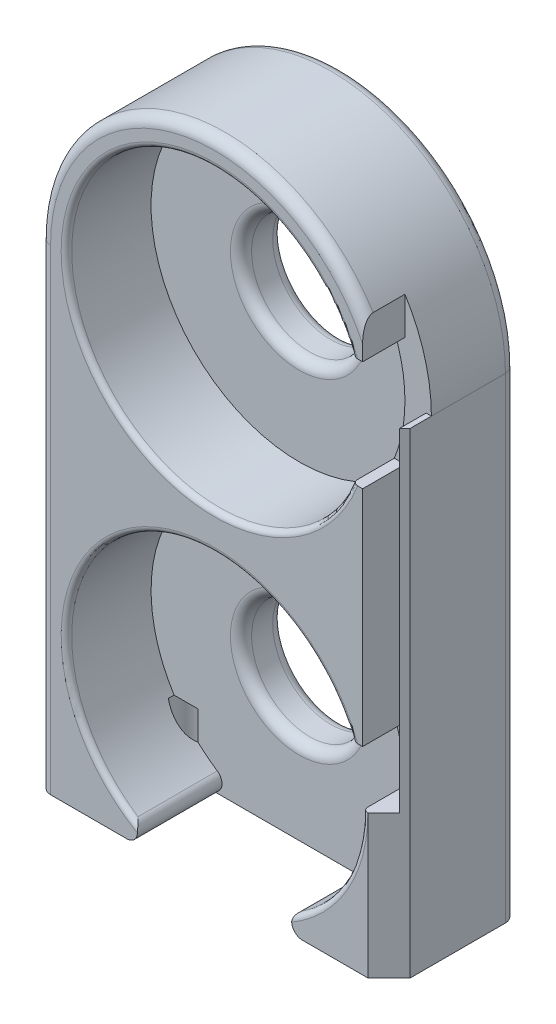
from build123d import *

# Parameters (mm, degrees)
ESBO_O1_R                = 5.5
RESSALTO_EXTRUS_O1_DEPTH = 12
ESBO_O2_R                = 14
CORTE_EXTRUS_O1_DEPTH    = 8
CORTE_EXTRUS_O2_DEPTH    = 4
FILETE7_R                = 1
FILETE9_R                = 0.5
ESBO_O6_R                = 1.75
CORTE_EXTRUS_O3_DEPTH    = 6
CHANFRO1_SIZE            = 2
FILETE10_R               = 1


with BuildPart() as part:
    # Esboço1 → Ressalto-extrusão1 (new body)
    with BuildSketch(Plane.XY):
        with BuildLine():
            Line((-16.5, 0), (-16.5, 45))
            ThreePointArc((-16.5, 45), (0, 61.5), (16.5, 45))
            Line((16.5, 45), (16.5, 0))
            Line((16.5, 0), (-16.5, 0))
        make_face()
        with Locations((0, 45)):
            Circle(ESBO_O1_R, mode=Mode.SUBTRACT)
        with Locations((0, 13.5)):
            Circle(ESBO_O1_R, mode=Mode.SUBTRACT)
    extrude(amount=RESSALTO_EXTRUS_O1_DEPTH)

    # Esboço2 → Corte-extrusão1 (cut)
    with BuildSketch(Plane.XY.offset(12)):
        with Locations((0, 45)):
            Circle(ESBO_O2_R)
        with Locations((0, 13.5)):
            Circle(ESBO_O2_R)
    extrude(amount=-CORTE_EXTRUS_O1_DEPTH, mode=Mode.SUBTRACT)

    # Esboço5 → Corte-extrusão2 (cut)
    with BuildSketch(Plane.XY.offset(12)):
        Polygon((16, 13.5), (16, 45), (16.5, 45), (18, 45), (18, 49.031128874), (16, 49.031128874), (16, 53.732124598), (14, 53.732124598), (14, 50.196152423), (13, 50.196152423), (13, 39.803847577), (14, 39.803847577), (14, 18.696152423), (13, 18.696152423), (13, 13.5), (14, 13.5), align=None)
    extrude(amount=-CORTE_EXTRUS_O2_DEPTH, mode=Mode.SUBTRACT)

    # Filete7
    filete7_edges = [part.edges().sort_by_distance(p)[0] for p in [
        (-5.5, 45, 0),
        (-5.5, 13.5, 0),
        (-16.5, 22.5, 12),
        (-5.5, 45, 4),
        (-5.5, 13.5, 4),
        (-4.541475531, 60.862692079, 12),
        (-16.5, 22.5, 0),
        (0, 61.5, 0),
        (16.5, 22.5, 0),
    ]]
    fillet(filete7_edges, radius=FILETE7_R)

    # Filete9
    filete9_edges = [part.edges().sort_by_distance(p)[0] for p in [
        (-14, 45, 12),
        (11.133584091, 5.01216722, 12),
        (-10.43893595, 22.828912918, 12),
    ]]
    fillet(filete9_edges, radius=FILETE9_R)

    # Esboço6 → Corte-extrusão3 (cut)
    with BuildSketch(Plane.XZ):
        with Locations(Location((-14, 9, 0), (0, 0, 270))):
            Circle(ESBO_O6_R)
        with Locations(Location((14, 9, 0), (0, 0, 270))):
            Circle(ESBO_O6_R)
        with Locations(Location((11, 3, 0), (0, 0, 270))):
            Circle(ESBO_O6_R)
        with Locations(Location((-11, 3, 0), (0, 0, 270))):
            Circle(ESBO_O6_R)
    extrude(amount=-CORTE_EXTRUS_O3_DEPTH, mode=Mode.SUBTRACT)

    # Chanfro1
    chanfro1_edges = [part.edges().sort_by_distance(p)[0] for p in [
        (16.5, 22.5, 12),
    ]]
    chamfer(chanfro1_edges, length=CHANFRO1_SIZE)

    # Filete10
    # the kernel refuses this fillet: 1 mm, written as the material it takes off along each edge
    with BuildSketch(Plane(origin=(3.708099244, 0, 4), x_dir=(1, 0, 0), z_dir=(0, 0, 1))) as filete10_piece_1:
        with BuildLine():
            CenterArc((4.583462732, 1), FILETE10_R, 123.557309762, 146.442690238)
            Line((4.030691934, 1.833333333), (4.019636518, 1.85))
            ThreePointArc((4.019636518, 1.85), (2.080007255, 0.774504994), (-0.005297285, 0.019285714))
            Line((-0.005297285, 0.019285714), (0, -0.02))
            Line((0, -0.02), (4.583462732, -0.02))
            Line((4.583462732, -0.02), (4.583462732, 0))
        make_face()
    extrude(amount=12.083462732, mode=Mode.SUBTRACT)
    with BuildSketch(Plane(origin=(-3.708099244, 0, 4), x_dir=(-1, 0, 0), z_dir=(0, 0, 1))) as filete10_piece_2:
        with BuildLine():
            CenterArc((4.583462732, -1), FILETE10_R, 90, 146.442690238)
            Line((4.030691934, -1.833333333), (4.019636518, -1.85))
            ThreePointArc((4.019636518, -1.85), (2.080007255, -0.774504994), (-0.005297285, -0.019285714))
            Line((-0.005297285, -0.019285714), (0, 0.02))
            Line((0, 0.02), (4.583462732, 0.02))
            Line((4.583462732, 0.02), (4.583462732, 0))
        make_face()
    extrude(amount=12.083462732, mode=Mode.SUBTRACT)


solid = part.part
